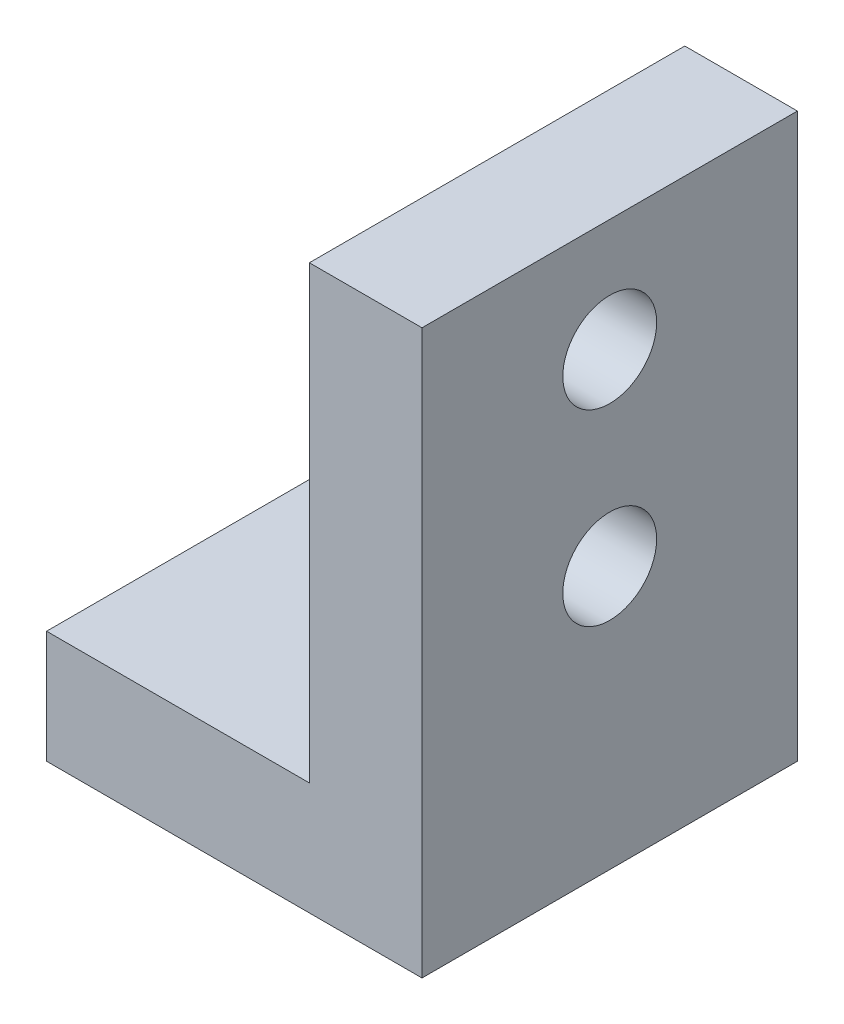
from build123d import *

# Parameters (mm, degrees)
RESSALTO_EXTRUS_O1_DEPTH = 20
ESBO_O2_R                = 2.5
CORTE_EXTRUS_O1_DEPTH    = 38.094473982


with BuildPart() as part:
    # Esboço1 → Ressalto-extrusão1 (new body)
    with BuildSketch(Plane.XY):
        Polygon((0, 0), (0, -6), (20, -6), (20, 24), (14, 24), (14, 0), align=None)
    extrude(amount=-RESSALTO_EXTRUS_O1_DEPTH)

    # Esboço2 → Corte-extrusão1 (cut, through all)
    with BuildSketch(Plane(origin=(20, 0, 0), x_dir=(0, 0, -1), z_dir=(1, 0, 0))):
        with Locations((10, 18)):
            Circle(ESBO_O2_R)
        with Locations((10, 8)):
            Circle(ESBO_O2_R)
    extrude(amount=-CORTE_EXTRUS_O1_DEPTH, mode=Mode.SUBTRACT)


solid = part.part
